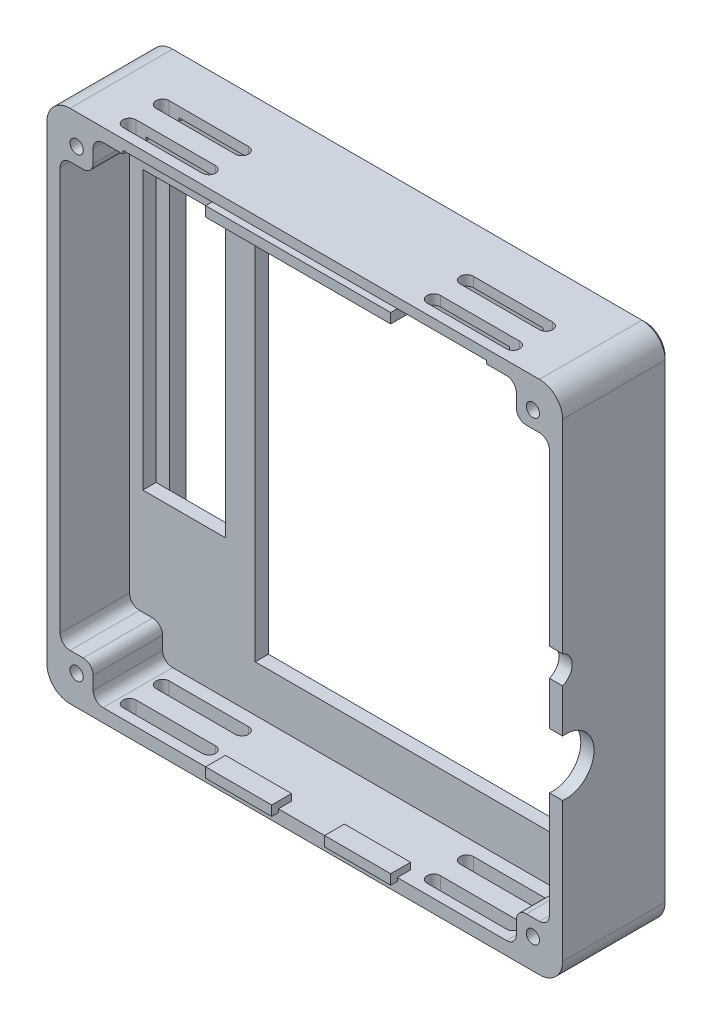
from build123d import *

# Parameters (mm, degrees)
SKETCH_1_W           = 78
SKETCH_1_H           = 78
EXTRUDE_1_DEPTH      = 5.5
SKETCH_2_W           = 78
SKETCH_2_H           = 78
EXTRUDE_2_DEPTH      = 10.5
FILLET_1_R           = 1.5
FILLET_2_R           = 3.5
CUT_EXTRUDE_1_DEPTH  = 1
CUT_EXTRUDE_2_DEPTH  = 2.5
SKETCH_5_R           = 1
CUT_EXTRUDE_3_DEPTH  = 58.15767665
CHAMFER_1_SIZE       = 0.5
SKETCH_6_W           = 55
SKETCH_6_H           = 2
SKETCH_6_W_2         = 54
SKETCH_6_H_2         = 58
SKETCH_6_W_3         = 12.5
SKETCH_6_H_3         = 42
CUT_EXTRUDE_4_DEPTH  = 57.553072419
EXTRUDE_3_DEPTH      = 1
EXTRUDE_3_DEPTH_BACK = 2
SKETCH_7_W           = 10
SKETCH_7_H           = 1.5
SKETCH_7_W_2         = 28
SKETCH_8_R           = 4.25
SKETCH_8_R_2         = 2.247220505
CUT_EXTRUDE_5_DEPTH  = 10
CUT_EXTRUDE_6_DEPTH  = 89.848185125


with BuildPart() as part:
    # 草图1 → 凸台-拉伸1 (new body)
    with BuildSketch(Plane.XY):
        Rectangle(SKETCH_1_W, SKETCH_1_H)
    extrude(amount=EXTRUDE_1_DEPTH)

    # 草图2 → 凸台-拉伸2 (add)
    with BuildSketch(Plane.XY.offset(5.5)):
        Rectangle(SKETCH_2_W, SKETCH_2_H)
        Polygon((-32, 37), (32, 37), (32, 32), (37, 32), (37, -32), (32, -32), (32, -37), (-32, -37), (-32, -32), (-37, -32), (-37, 32), (-32, 32), align=None, mode=Mode.SUBTRACT)
    extrude(amount=EXTRUDE_2_DEPTH)

    # 圆角1
    fillet_1_edges = [part.edges().sort_by_distance(p)[0] for p in [
        (37, 32, 10.75),
        (32, 32, 10.75),
        (32, 37, 10.75),
        (37, -32, 10.75),
        (32, -32, 10.75),
        (32, -37, 10.75),
        (-32, -37, 10.75),
        (-32, -32, 10.75),
        (-37, -32, 10.75),
        (-37, 32, 10.75),
        (-32, 37, 10.75),
        (-32, 32, 10.75),
    ]]
    fillet(fillet_1_edges, radius=FILLET_1_R)

    # 圆角2
    fillet_2_edges = [part.edges().sort_by_distance(p)[0] for p in [
        (-39, 39, 8),
        (39, 39, 8),
        (39, -39, 8),
        (-39, -39, 8),
    ]]
    fillet(fillet_2_edges, radius=FILLET_2_R)

    # 草图3 → 切除-拉伸1 (cut)
    with BuildSketch(Plane(origin=(0, 0, 0), x_dir=(-1, 0, 0), z_dir=(0, 0, -1))):
        with BuildLine():
            Line((37.5, -35.5), (37.5, 35.5))
            ThreePointArc((37.5, 35.5), (36.914213562, 36.914213562), (35.5, 37.5))
            Line((35.5, 37.5), (-35.5, 37.5))
            ThreePointArc((-35.5, 37.5), (-36.914213562, 36.914213562), (-37.5, 35.5))
            Line((-37.5, 35.5), (-37.5, -35.5))
            ThreePointArc((-37.5, -35.5), (-36.914213562, -36.914213562), (-35.5, -37.5))
            Line((-35.5, -37.5), (35.5, -37.5))
            ThreePointArc((35.5, -37.5), (36.914213562, -36.914213562), (37.5, -35.5))
        make_face()
    extrude(amount=-CUT_EXTRUDE_1_DEPTH, mode=Mode.SUBTRACT)

    # 草图4 → 切除-拉伸2 (cut)
    with BuildSketch(Plane(origin=(0, 0, 1), x_dir=(-1, 0, 0), z_dir=(0, 0, -1))):
        Polygon((27.5, 37.5), (-27.5, 37.5), (-27.5, 36.85), (-32.95, 36.85), (-32.95, -33), (32.95, -33), (32.95, 36.85), (27.5, 36.85), align=None)
    extrude(amount=-CUT_EXTRUDE_2_DEPTH, mode=Mode.SUBTRACT)

    # 草图5 → 切除-拉伸3 (cut, through all)
    with BuildSketch(Plane(origin=(0, 0, 1), x_dir=(-1, 0, 0), z_dir=(0, 0, -1))):
        with Locations((-34.5, 34.5)):
            Circle(SKETCH_5_R)
        with Locations((34.5, 34.5)):
            Circle(SKETCH_5_R)
        with Locations((34.5, -34.5)):
            Circle(SKETCH_5_R)
        with Locations((-34.5, -34.5)):
            Circle(SKETCH_5_R)
    extrude(amount=-CUT_EXTRUDE_3_DEPTH, mode=Mode.SUBTRACT)

    # 倒角1
    chamfer_1_edges = [part.edges().sort_by_distance(p)[0] for p in [
        (-39, 0, 0),
        (-37.974873734, -37.974873734, 0),
        (-37.974873734, 37.974873734, 0),
        (0, -39, 0),
        (0, 39, 0),
        (37.974873734, -37.974873734, 0),
        (37.974873734, 37.974873734, 0),
        (39, 0, 0),
    ]]
    chamfer(chamfer_1_edges, length=CHAMFER_1_SIZE)

    # 草图6 → 切除-拉伸4 (cut, through all)
    with BuildSketch(Plane(origin=(0, 0, 3.5), x_dir=(-1, 0, 0), z_dir=(0, 0, -1))):
        with Locations((0, 36.5)):
            Rectangle(SKETCH_6_W, SKETCH_6_H)
        with Locations((-9, -1)):
            Rectangle(SKETCH_6_W_2, SKETCH_6_H_2)
        with Locations((28.75, 5)):
            Rectangle(SKETCH_6_W_3, SKETCH_6_H_3)
    extrude(amount=-CUT_EXTRUDE_4_DEPTH, mode=Mode.SUBTRACT)

    # 草图7 → 凸台-拉伸3 (add, two sides: drawn at the far end of the back side and taken through both)
    with BuildSketch(Plane.XY.offset(16).offset(-EXTRUDE_3_DEPTH_BACK)):
        with Locations((9, -36.75)):
            Rectangle(SKETCH_7_W, SKETCH_7_H)
        with Locations((-9, -36.75)):
            Rectangle(SKETCH_7_W, SKETCH_7_H)
        with Locations((0, 36.75)):
            Rectangle(SKETCH_7_W_2, SKETCH_7_H)
    extrude(amount=EXTRUDE_3_DEPTH + EXTRUDE_3_DEPTH_BACK)

    # 草图8 → 切除-拉伸5 (cut)
    with BuildSketch(Plane(origin=(39, 0, 0), x_dir=(0, 0, -1), z_dir=(1, 0, 0))):
        with Locations((-15.5, -10.2)):
            Circle(SKETCH_8_R)
        with Locations((-16.8, 2.7)):
            Circle(SKETCH_8_R_2)
    extrude(amount=-CUT_EXTRUDE_5_DEPTH, mode=Mode.SUBTRACT)

    # 草图9 → 切除-拉伸6 (cut, through all)
    with BuildSketch(Plane.XZ.offset(39)):
        with BuildLine():
            Line((-29, 14.5), (-17, 14.5))
            ThreePointArc((-17, 14.5), (-16, 13.5), (-17, 12.5))
            Line((-17, 12.5), (-29, 12.5))
            ThreePointArc((-29, 12.5), (-30, 13.5), (-29, 14.5))
        make_face()
        with BuildLine():
            Line((-29, 9.5), (-17, 9.5))
            ThreePointArc((-17, 9.5), (-16, 8.5), (-17, 7.5))
            Line((-17, 7.5), (-29, 7.5))
            ThreePointArc((-29, 7.5), (-30, 8.5), (-29, 9.5))
        make_face()
        with BuildLine():
            Line((29, 9.5), (17, 9.5))
            ThreePointArc((17, 9.5), (16, 8.5), (17, 7.5))
            Line((17, 7.5), (29, 7.5))
            ThreePointArc((29, 7.5), (30, 8.5), (29, 9.5))
        make_face()
        with BuildLine():
            Line((29, 14.5), (17, 14.5))
            ThreePointArc((17, 14.5), (16, 13.5), (17, 12.5))
            Line((17, 12.5), (29, 12.5))
            ThreePointArc((29, 12.5), (30, 13.5), (29, 14.5))
        make_face()
    extrude(amount=-CUT_EXTRUDE_6_DEPTH, mode=Mode.SUBTRACT)


solid = part.part
